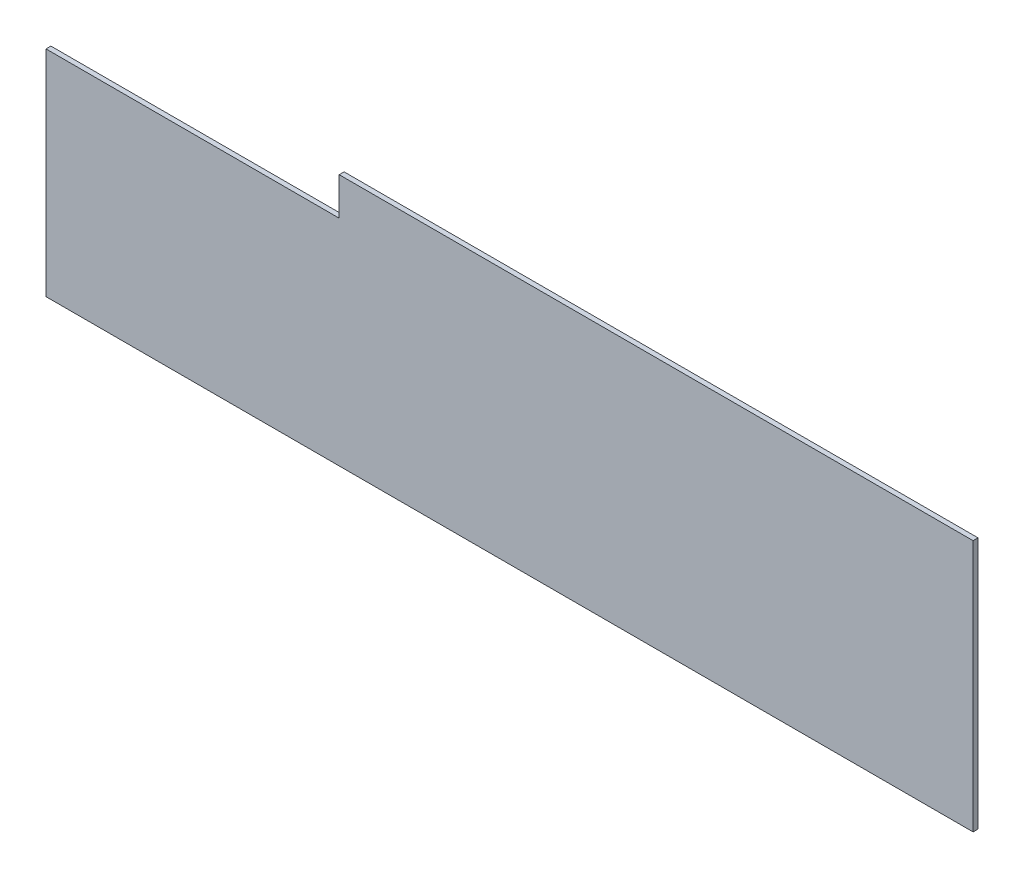
from build123d import *

# Parameters (mm, degrees)
TABAN_FLAN_1_DEPTH         = 30
KES_EKSTR_ZYON1_DEPTH      = 6219.771984886
KES_EKSTR_ZYON1_DEPTH_BACK = 6219.771984886
IZIM2_W                    = 365
IZIM2_H                    = 658
KES_EKSTR_ZYON2_DEPTH      = 6219.771984886
KES_EKSTR_ZYON2_DEPTH_BACK = 6219.771984886
IZIM3_W                    = 365
IZIM3_H                    = 127


# Sheet-metal steps are written as plain solids
with BuildPart() as part:
    # Çizim1 → Taban-Flanş1 (new body)
    with BuildSketch(Plane.XY):
        Polygon((0, 0), (0, -1015), (365, -1015), (365, -1540), (6025, -1540), (6025, 0), align=None)
    extrude(amount=-TABAN_FLAN_1_DEPTH)

    # Çizim2 → Kes-Ekstrüzyon1 (cut, two sides: drawn at the far end of the back side and taken through both)
    with BuildSketch(Plane.XY.offset(-KES_EKSTR_ZYON1_DEPTH_BACK)):
        with Locations((182.5, -686)):
            Rectangle(IZIM2_W, IZIM2_H)
    extrude(amount=KES_EKSTR_ZYON1_DEPTH + KES_EKSTR_ZYON1_DEPTH_BACK, mode=Mode.SUBTRACT)

    # Çizim3 → Kes-Ekstrüzyon2 (cut, two sides: drawn at the far end of the back side and taken through both)
    with BuildSketch(Plane.XY.offset(-KES_EKSTR_ZYON2_DEPTH_BACK)):
        with Locations((182.5, -293.5)):
            Rectangle(IZIM3_W, IZIM3_H)
        Polygon((2155, 0), (0, 0), (0, -230), (365, -230), (2155, -230), align=None)
    extrude(amount=KES_EKSTR_ZYON2_DEPTH + KES_EKSTR_ZYON2_DEPTH_BACK, mode=Mode.SUBTRACT)


solid = part.part
